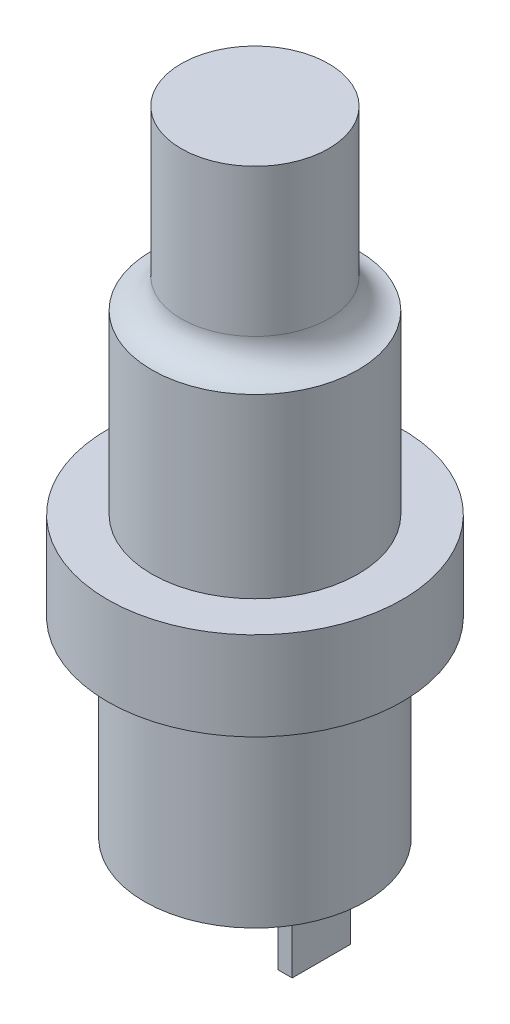
from build123d import *

# Parameters (mm, degrees)
SKETCH_1_R      = 3.75
EXTRUDE_1_DEPTH = 6.5
SKETCH_2_R      = 5
EXTRUDE_2_DEPTH = 3
SKETCH_3_R      = 3.5
EXTRUDE_3_DEPTH = 6
SKETCH_4_R      = 2.5
EXTRUDE_4_DEPTH = 6
FILLET_1_R      = 1
SKETCH_5_W      = 0.48356718
SKETCH_5_H      = 1.971466194
EXTRUDE_5_DEPTH = 2.5


with BuildPart() as part:
    # Эскиз1 → Бобышка-Вытянуть1 (new body)
    with BuildSketch(Plane(origin=(0, 0, 0), x_dir=(1, 0, 0), z_dir=(0, 1, 0))):
        with Locations(Location((0, 0, 0), (0, 0, 90))):
            Circle(SKETCH_1_R)
    extrude(amount=EXTRUDE_1_DEPTH)

    # Эскиз2 → Бобышка-Вытянуть2 (add)
    with BuildSketch(Plane(origin=(0, 6.5, 0), x_dir=(1, 0, 0), z_dir=(0, 1, 0))):
        with Locations(Location((0, 0, 0), (0, 0, 270))):
            Circle(SKETCH_2_R)
    extrude(amount=EXTRUDE_2_DEPTH)

    # Эскиз3 → Бобышка-Вытянуть3 (add)
    with BuildSketch(Plane(origin=(0, 9.5, 0), x_dir=(1, 0, 0), z_dir=(0, 1, 0))):
        with Locations(Location((0, 0, 0), (0, 0, 270))):
            Circle(SKETCH_3_R)
    extrude(amount=EXTRUDE_3_DEPTH)

    # Эскиз4 → Бобышка-Вытянуть4 (add)
    with BuildSketch(Plane(origin=(0, 15.5, 0), x_dir=(1, 0, 0), z_dir=(0, 1, 0))):
        with Locations(Location((0, 0, 0), (0, 0, 270))):
            Circle(SKETCH_4_R)
    extrude(amount=EXTRUDE_4_DEPTH)

    # Скругление1
    fillet_1_edges = [part.edges().sort_by_distance(p)[0] for p in [
        (0, 15.5, -2.5),
    ]]
    fillet(fillet_1_edges, radius=FILLET_1_R - 0.0001)  # a hair under: the kernel refuses the full size

    # Эскиз5 → Бобышка-Вытянуть5 (add)
    with BuildSketch(Plane.XZ):
        with Locations((2.00821641, 0)):
            Rectangle(SKETCH_5_W, SKETCH_5_H)
        with Locations((-2.00821641, 0)):
            Rectangle(SKETCH_5_W, SKETCH_5_H)
    extrude(amount=EXTRUDE_5_DEPTH)


solid = part.part
